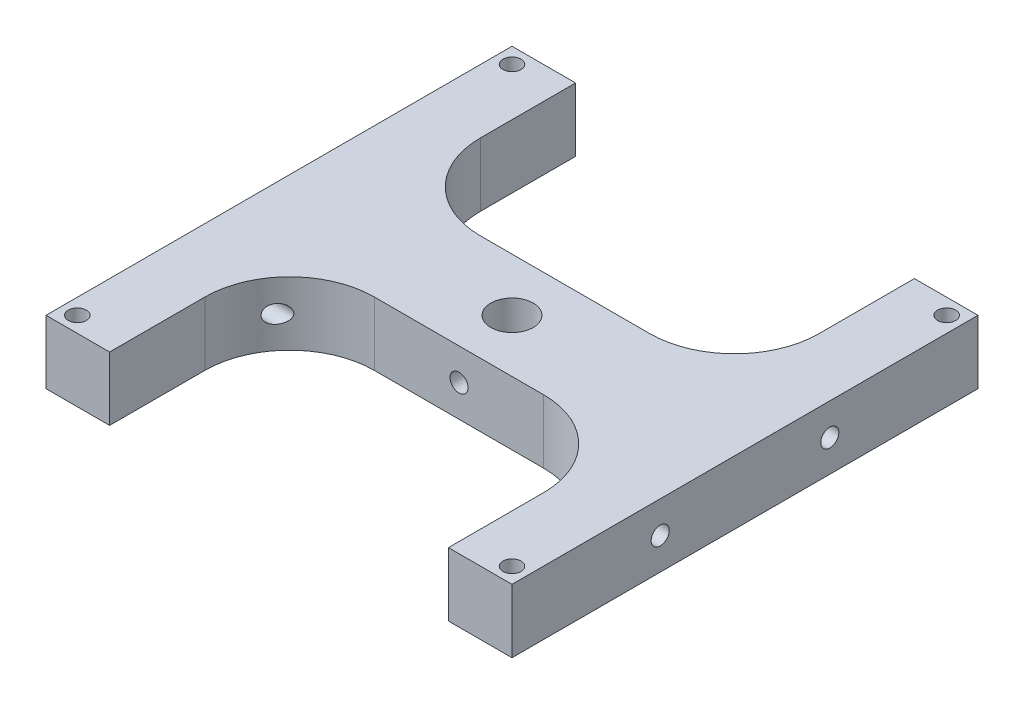
from build123d import *

# Parameters (mm, degrees)
SKETCH1_W                 = 76.2
SKETCH1_H                 = 76.2
BOSS_EXTRUDE1_DEPTH       = 3.175
SKETCH2_W                 = 69.79412
SKETCH2_H                 = 69.79412
BOSS_EXTRUDE2_DEPTH       = 9.525
F_6_32_TAPPED_HOLE1_D     = 2.7051
CIRPATTERN1_COUNT         = 4
SKETCH14_R                = 3.175
CUT_EXTRUDE1_DEPTH        = 56.358016583
SKETCH15_W                = 50.74412
SKETCH15_H                = 26.95956
CUT_EXTRUDE2_DEPTH        = 9.525
FILLET1_R                 = 12.7
F_6_32_TAPPED_HOLE2_D     = 2.7051
F_6_32_TAPPED_HOLE2_DEPTH = 9.652
F_6_32_TAPPED_HOLE2_TIP   = 0.81269403
FILLET1_OF_MIRROR3_R      = 12.7
SKETCH21_W                = 76.2
SKETCH21_H                = 76.2
CUT_EXTRUDE3_DEPTH        = 3.175


with BuildPart() as part:
    # Sketch1 → Boss-Extrude1 (new body)
    with BuildSketch(Plane(origin=(0, 0, 0), x_dir=(1, 0, 0), z_dir=(0, 1, 0))):
        Rectangle(SKETCH1_W, SKETCH1_H)
    extrude(amount=BOSS_EXTRUDE1_DEPTH)

    # Sketch2 → Boss-Extrude2 (add)
    with BuildSketch(Plane(origin=(0, 3.175, 0), x_dir=(1, 0, 0), z_dir=(0, 1, 0))):
        Rectangle(SKETCH2_W, SKETCH2_H)
    extrude(amount=BOSS_EXTRUDE2_DEPTH)

    # Sketch9 → #6-32 Tapped Hole3 (revolve, cut)
    with BuildSketch(Plane(origin=(34.89706, 7.9375, 12.7), x_dir=(0, 0, -1), z_dir=(0, 1, 0))):
        Polygon((0, 0), (0, 11.98869403), (1.35255, 11.176), (1.35255, 0), align=None)
    f_6_32_tapped_hole3 = revolve(axis=Axis((41.24706, 7.9375, 12.7), (-1, 0, 0)), mode=Mode.SUBTRACT)

    # Mirror1: #6-32 Tapped Hole3 across plane
    add(f_6_32_tapped_hole3.mirror(Plane.XY), mode=Mode.SUBTRACT)

    # Mirror2: #6-32 Tapped Hole3 across plane
    add(f_6_32_tapped_hole3.mirror(Plane(origin=(0, 0, 0), x_dir=(0, 0, 1), z_dir=(1, 0, 0))), mode=Mode.SUBTRACT)

    # Mirror2 copy 1 sketch → Mirror2 copy 1 (revolve, cut)
    with BuildSketch(Plane(origin=(-34.89706, 7.9375, -12.7), x_dir=(0, 0, 1), z_dir=(0, 1, 0))):
        Polygon((0, 0), (0, 11.98869403), (1.35255, 11.176), (1.35255, 0), align=None)
    revolve(axis=Axis((-41.24706, 7.9375, -12.7), (1, 0, 0)), mode=Mode.SUBTRACT)

    # #6-32 Tapped Hole1 (through all)
    with Locations(Plane(origin=(0, 0, 0), x_dir=(-1, 0, 0), z_dir=(0, -1, 0))):
        with Locations((-32.5501, 32.5501)):
            f_6_32_tapped_hole1 = Hole(F_6_32_TAPPED_HOLE1_D / 2)

    # CirPattern1: #6-32 Tapped Hole1 ×4 about axis
    cirpattern1_axis = Axis((0, 0, 0), (0, 1, 0))
    for i in range(1, CIRPATTERN1_COUNT):
        add(f_6_32_tapped_hole1.rotate(cirpattern1_axis, i * 360 / CIRPATTERN1_COUNT), mode=Mode.SUBTRACT)

    # Sketch14 → Cut-Extrude1 (cut, through all)
    with BuildSketch(Plane.XZ):
        with Locations(Location((0, 0, 0), (0, 0, 270))):
            Circle(SKETCH14_R)
    extrude(amount=-CUT_EXTRUDE1_DEPTH, mode=Mode.SUBTRACT)

    # Sketch15 → Cut-Extrude2 (cut)
    with BuildSketch(Plane(origin=(0, 12.7, 0), x_dir=(1, 0, 0), z_dir=(0, 1, 0))):
        with Locations((0, -21.41728)):
            Rectangle(SKETCH15_W, SKETCH15_H)
    cut_extrude2 = extrude(amount=-CUT_EXTRUDE2_DEPTH, mode=Mode.SUBTRACT)

    # Fillet1
    # the kernel refuses this fillet: 12.7 mm, written as the material it adds along each edge
    with BuildSketch(Plane(origin=(25.37206, 12.7, 7.9375), x_dir=(0, 0, 1), z_dir=(0, -1, 0))) as fillet1_piece_1_section:
        with BuildLine():
            CenterArc((FILLET1_R, FILLET1_R), FILLET1_R, 180, 90)
            Line((0, FILLET1_R), (0, 0))
            Line((0, 0), (FILLET1_R, 0))
        make_face()
    fillet1_piece_1 = extrude(amount=9.525, mode=Mode.PRIVATE)
    fillet1_piece_1 = fillet1_piece_1 - Plane(origin=(22.423937315, 7.9375, 12.7), x_dir=(0, 0, -1), z_dir=(1, 0, 0)) * Cylinder(1.35255, 70, mode=Mode.PRIVATE)
    add(fillet1_piece_1)
    with BuildSketch(Plane(origin=(-25.37206, 12.7, 7.9375), x_dir=(1, 0, 0), z_dir=(0, -1, 0))) as fillet1_piece_2_section:
        with BuildLine():
            CenterArc((FILLET1_R, FILLET1_R), FILLET1_R, 180, 90)
            Line((0, FILLET1_R), (0, 0))
            Line((0, 0), (FILLET1_R, 0))
        make_face()
    fillet1_piece_2 = extrude(amount=9.525, mode=Mode.PRIVATE)
    fillet1_piece_2 = fillet1_piece_2 - Plane(origin=(-22.423935797, 7.9375, 12.7), x_dir=(0, 0, -1), z_dir=(-1, 0, 0)) * Cylinder(1.35255, 70, mode=Mode.PRIVATE)
    add(fillet1_piece_2)

    # #6-32 Tapped Hole2
    with Locations(Plane.XY.offset(7.9375)):
        with Locations((0, 7.9375)):
            Hole(F_6_32_TAPPED_HOLE2_D / 2, depth=F_6_32_TAPPED_HOLE2_DEPTH)
            with Locations((0, 0, -(F_6_32_TAPPED_HOLE2_DEPTH + F_6_32_TAPPED_HOLE2_TIP / 2))):  # 118° drill point
                Cone(0, F_6_32_TAPPED_HOLE2_D / 2, F_6_32_TAPPED_HOLE2_TIP, mode=Mode.SUBTRACT)

    # Mirror3: Cut-Extrude2 across plane
    add(cut_extrude2.mirror(Plane.XY), mode=Mode.SUBTRACT)

    # Fillet1 of Mirror3
    # the kernel refuses this fillet: 12.7 mm, written as the material it adds along each edge
    with BuildSketch(Plane(origin=(25.37206, 12.7, -7.9375), x_dir=(-1, 0, 0), z_dir=(0, -1, 0))) as fillet1_of_mirror3_piece_1_section:
        with BuildLine():
            CenterArc((FILLET1_OF_MIRROR3_R, FILLET1_OF_MIRROR3_R), FILLET1_OF_MIRROR3_R, 180, 90)
            Line((0, FILLET1_OF_MIRROR3_R), (0, 0))
            Line((0, 0), (FILLET1_OF_MIRROR3_R, 0))
        make_face()
    fillet1_of_mirror3_piece_1 = extrude(amount=9.525, mode=Mode.PRIVATE)
    fillet1_of_mirror3_piece_1 = fillet1_of_mirror3_piece_1 - Plane(origin=(22.423935797, 7.9375, -12.7), x_dir=(0, 0, 1), z_dir=(1, 0, 0)) * Cylinder(1.35255, 70, mode=Mode.PRIVATE)
    add(fillet1_of_mirror3_piece_1)
    with BuildSketch(Plane(origin=(-25.37206, 12.7, -7.9375), x_dir=(0, 0, -1), z_dir=(0, -1, 0))) as fillet1_of_mirror3_piece_2_section:
        with BuildLine():
            CenterArc((FILLET1_OF_MIRROR3_R, FILLET1_OF_MIRROR3_R), FILLET1_OF_MIRROR3_R, 180, 90)
            Line((0, FILLET1_OF_MIRROR3_R), (0, 0))
            Line((0, 0), (FILLET1_OF_MIRROR3_R, 0))
        make_face()
    fillet1_of_mirror3_piece_2 = extrude(amount=9.525, mode=Mode.PRIVATE)
    fillet1_of_mirror3_piece_2 = fillet1_of_mirror3_piece_2 - Plane(origin=(-22.423937315, 7.9375, -12.7), x_dir=(0, 0, 1), z_dir=(-1, 0, 0)) * Cylinder(1.35255, 70, mode=Mode.PRIVATE)
    add(fillet1_of_mirror3_piece_2)

    # Sketch21 → Cut-Extrude3 (cut)
    with BuildSketch(Plane.XZ):
        Rectangle(SKETCH21_W, SKETCH21_H)
    extrude(amount=-CUT_EXTRUDE3_DEPTH, mode=Mode.SUBTRACT)


solid = part.part
